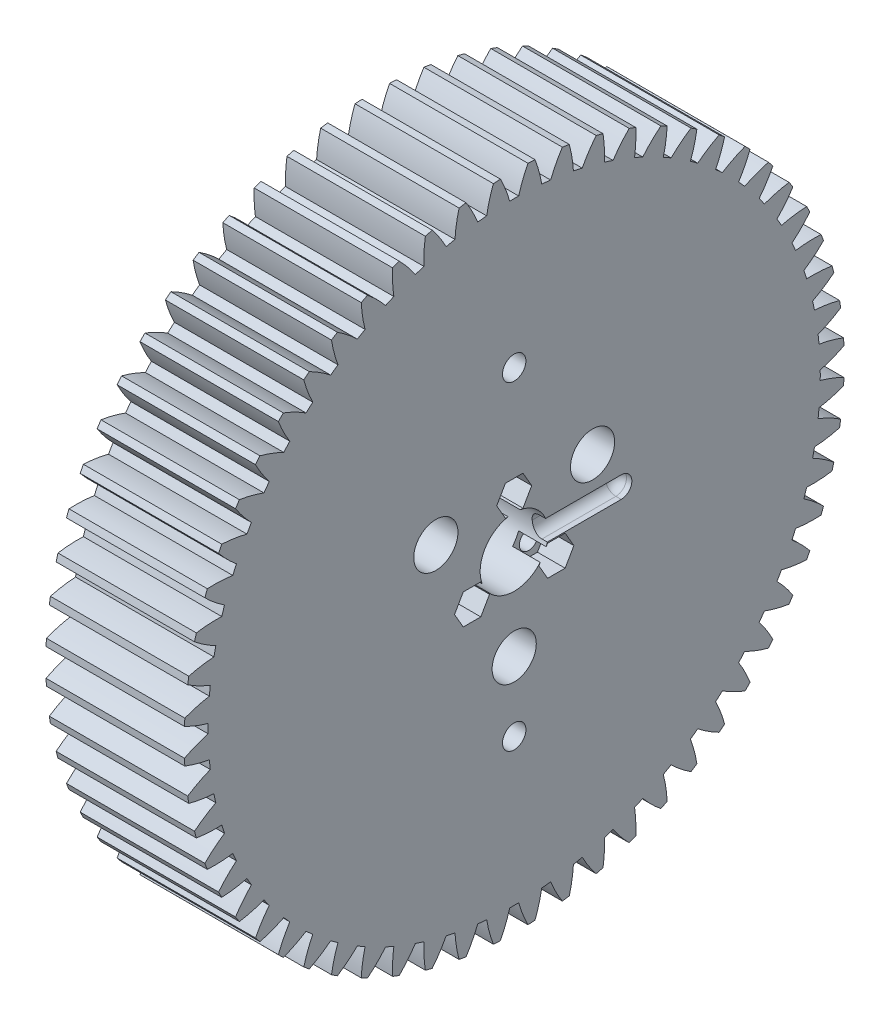
from build123d import *

# Parameters (mm, degrees)
BASPROSKE_W         = 26
BASPROSKE_H         = 62
TOOTHCUT_DEPTH      = 92.454906921
TEETHCUTS_COUNT     = 60
TEETHCUTS_ANGLE     = 354
BORSKE_R            = 12.25
BORE_DEPTH          = 50.0000508
SKETCH2_R           = 13.6
CUT_EXTRUDE1_DEPTH  = 1.5
SKETCH4_R           = 2.2
CUT_EXTRUDE2_DEPTH  = 92.381890262
SKETCH7_R           = 4.15
CUT_EXTRUDE3_DEPTH  = 17
SKETCH8_R           = 2.2
CUT_EXTRUDE4_DEPTH  = 92.381890262
CUT_EXTRUDE5_DEPTH  = 8.3
SKETCH11_R          = 12.25
SKETCH11_R_2        = 6.4
BOSS_EXTRUDE2_DEPTH = 16
SKETCH12_R          = 1.75
CUT_EXTRUDE7_DEPTH  = 16
CUT_EXTRUDE8_DEPTH  = 5.2
CUT_EXTRUDE9_DEPTH  = 3
FILLET1_R           = 2
SKETCH15_R          = 13.6
SKETCH15_R_2        = 12.25
BOSS_EXTRUDE3_DEPTH = 1.5
SKETCH16_R          = 23
SKETCH16_R_2        = 12.25
BOSS_EXTRUDE4_DEPTH = 7.5
SKETCH17_R          = 2.2
CUT_EXTRUDE10_DEPTH = 92.381890291
SKETCH18_R          = 13.6
CUT_EXTRUDE11_DEPTH = 1.5


with BuildPart() as part:
    # BasProSke → Base-Revolve (revolve)
    with BuildSketch(Plane(origin=(0, 0, 0), x_dir=(1, 0, 0), z_dir=(0, 1, 0)), mode=Mode.PRIVATE) as base_revolve_sk:
        with Locations((13, 31)):
            Rectangle(BASPROSKE_W, BASPROSKE_H)
    revolve(base_revolve_sk.sketch.rotate(Axis((-10, 0, 0), (1, 0, 0)), 180), axis=Axis((-10, 0, 0), (1, 0, 0)))

    # TooCutSke → ToothCut (cut, through all)
    with BuildSketch(Plane(origin=(0, 0, 0), x_dir=(0, 0, -1), z_dir=(1, 0, 0))):
        with BuildLine():
            ThreePointArc((0.845486153, 57.492783496), (0, 57.499), (-0.845486153, 57.492783496))
            ThreePointArc((-0.845486153, 57.492783496), (-1.608476959, 59.775867605), (-2.596335387, 61.971035877))
            ThreePointArc((-2.596335387, 61.971035877), (0, 62.0254), (2.596335387, 61.971035877))
            ThreePointArc((2.596335387, 61.971035877), (1.608476959, 59.775867605), (0.845486153, 57.492783496))
        make_face()
    toothcut = extrude(amount=TOOTHCUT_DEPTH, mode=Mode.SUBTRACT)

    # TeethCuts: ToothCut ×60 about axis
    teethcuts_axis = Axis((-10, 0, 0), (1, 0, 0))
    for i in range(1, TEETHCUTS_COUNT):
        add(toothcut.rotate(teethcuts_axis, i * TEETHCUTS_ANGLE / (TEETHCUTS_COUNT - 1)), mode=Mode.SUBTRACT)

    # BorSke → Bore (cut, symmetric)
    with BuildSketch(Plane(origin=(0, 0, 0), x_dir=(0, 0, -1), z_dir=(1, 0, 0))):
        with Locations(Location((0, 0, 0), (0, 0, 180))):
            Circle(BORSKE_R)
    extrude(amount=BORE_DEPTH, both=True, mode=Mode.SUBTRACT)

    # Sketch2 → Cut-Extrude1 (cut)
    with BuildSketch(Plane.ZY):
        Circle(SKETCH2_R)
    extrude(amount=-CUT_EXTRUDE1_DEPTH, mode=Mode.SUBTRACT)

    # Sketch4 → Cut-Extrude2 (cut, through all)
    with BuildSketch(Plane.ZY):
        with Locations((0, -17)):
            Circle(SKETCH4_R)
        with Locations((-14.722431864, 8.5)):
            Circle(SKETCH4_R)
        with Locations((14.722431864, 8.5)):
            Circle(SKETCH4_R)
    extrude(amount=-CUT_EXTRUDE2_DEPTH, mode=Mode.SUBTRACT)

    # Sketch7 → Cut-Extrude3 (cut)
    with BuildSketch(Plane(origin=(26, 0, 0), x_dir=(0, 0, -1), z_dir=(1, 0, 0))):
        with Locations((0, -17)):
            Circle(SKETCH7_R)
        with Locations((-14.722431864, 8.5)):
            Circle(SKETCH7_R)
        with Locations((14.722431864, 8.5)):
            Circle(SKETCH7_R)
    extrude(amount=-CUT_EXTRUDE3_DEPTH, mode=Mode.SUBTRACT)

    # Sketch8 → Cut-Extrude4 (cut, through all)
    with BuildSketch(Plane.ZY):
        with Locations((0, -30)):
            Circle(SKETCH8_R)
        with Locations((0, 30)):
            Circle(SKETCH8_R)
    extrude(amount=-CUT_EXTRUDE4_DEPTH, mode=Mode.SUBTRACT)

    # Sketch9 → Cut-Extrude5 (cut)
    with BuildSketch(Plane.ZY):
        Polygon((4.243524479, 30), (2.121762239, 33.675), (-2.121762239, 33.675), (-4.243524479, 30), (-2.121762239, 26.325), (2.121762239, 26.325), align=None)
        Polygon((4.243524479, -30), (2.121762239, -26.325), (-2.121762239, -26.325), (-4.243524479, -30), (-2.121762239, -33.675), (2.121762239, -33.675), align=None)
    extrude(amount=-CUT_EXTRUDE5_DEPTH, mode=Mode.SUBTRACT)

    # Sketch11 → Boss-Extrude2 (add)
    with BuildSketch(Plane(origin=(26, 0, 0), x_dir=(0, 0, -1), z_dir=(1, 0, 0))):
        with Locations(Location((0, 0, 0), (0, 0, 180))):
            Circle(SKETCH11_R)
        Circle(SKETCH11_R_2, mode=Mode.SUBTRACT)
    extrude(amount=-BOSS_EXTRUDE2_DEPTH)

    # Sketch12 → Cut-Extrude7 (cut)
    with BuildSketch(Plane.ZY.offset(-10)):
        with Locations((0, 9.148294209)):
            Circle(SKETCH12_R)
        with Locations((7.922655187, -4.574147105)):
            Circle(SKETCH12_R)
        with Locations((-7.922655187, -4.574147105)):
            Circle(SKETCH12_R)
    extrude(amount=-CUT_EXTRUDE7_DEPTH, mode=Mode.SUBTRACT)

    # Sketch13 → Cut-Extrude8 (cut)
    with BuildSketch(Plane(origin=(26, 0, 0), x_dir=(0, 0, -1), z_dir=(1, 0, 0))):
        Polygon((6.277206919, -7.424147105), (9.568103454, -7.424147105), (11.213551721, -4.574147105), (9.568103454, -1.724147105), (6.277206919, -1.724147105), (4.631758652, -4.574147105), align=None)
        Polygon((3.290896534, 9.148294209), (1.645448267, 11.998294209), (-1.645448267, 11.998294209), (-3.290896534, 9.148294209), (-1.645448267, 6.298294209), (1.645448267, 6.298294209), align=None)
        Polygon((-9.568103454, -1.724147105), (-11.213551721, -4.574147105), (-9.568103454, -7.424147105), (-6.277206919, -7.424147105), (-4.631758652, -4.574147105), (-6.277206919, -1.724147105), align=None)
    extrude(amount=-CUT_EXTRUDE8_DEPTH, mode=Mode.SUBTRACT)

    # Sketch14 → Cut-Extrude9 (cut)
    with BuildSketch(Plane(origin=(26, 0, 0), x_dir=(0, 0, -1), z_dir=(1, 0, 0))):
        with BuildLine():
            Line((0.101802401, -1.50300776), (20.101802401, -1.50300776))
            ThreePointArc((20.101802401, -1.50300776), (22.101802401, 0.49699224), (20.101802401, 2.49699224))
            Line((20.101802401, 2.49699224), (0.101802401, 2.49699224))
            Line((0.101802401, 2.49699224), (0.101802401, -1.50300776))
        make_face()
    extrude(amount=-CUT_EXTRUDE9_DEPTH, mode=Mode.SUBTRACT)

    # Fillet1
    # the kernel refuses this fillet: 2 mm, written as the material it adds along each edge
    with BuildSketch(Plane(origin=(23, -1.50300776, -1.221010181), x_dir=(1, 0, 0), z_dir=(0, 0, -1))) as fillet1_piece_1_section:
        with BuildLine():
            CenterArc((FILLET1_R, -FILLET1_R), FILLET1_R, 90, 90)
            Line((0, -FILLET1_R), (0, 0))
            Line((0, 0), (FILLET1_R, 0))
        make_face()
    fillet1_piece_1 = extrude(amount=18.88079222, mode=Mode.PRIVATE)
    fillet1_piece_1 = fillet1_piece_1 - Plane(origin=(23.453945132, 0, 0), x_dir=(0, 0, -1), z_dir=(1, 0, 0)) * Cylinder(6.4, 46, mode=Mode.PRIVATE)
    add(fillet1_piece_1)
    with BuildSketch(Plane(origin=(23, 0.49699224, -20.101802401), x_dir=(0, -1, 0), z_dir=(0, 0, 1))) as fillet1_piece_2:
        with BuildLine():
            CenterArc((2 - FILLET1_R, FILLET1_R), FILLET1_R, 270, 90)
            Line((2 - FILLET1_R, 0), (2, 0))
            Line((2, 0), (2, FILLET1_R))
        make_face()
    revolve(axis=Axis((23, 0.49699224, -20.101802401), (1, 0, 0)), revolution_arc=180)
    with BuildSketch(Plane(origin=(23, 2.49699224, -20.101802401), x_dir=(1, 0, 0), z_dir=(0, 0, 1))) as fillet1_piece_3_section:
        with BuildLine():
            CenterArc((FILLET1_R, -FILLET1_R), FILLET1_R, 90, 90)
            Line((0, -FILLET1_R), (0, 0))
            Line((0, 0), (FILLET1_R, 0))
        make_face()
    fillet1_piece_3 = extrude(amount=19.209007669, mode=Mode.PRIVATE)
    fillet1_piece_3 = fillet1_piece_3 - Plane(origin=(23.455246058, 0, 0), x_dir=(0, 0, -1), z_dir=(1, 0, 0)) * Cylinder(6.4, 47, mode=Mode.PRIVATE)
    add(fillet1_piece_3)

    # Sketch15 → Boss-Extrude3 (add)
    with BuildSketch(Plane.ZY.offset(-1.5)):
        Circle(SKETCH15_R)
        Circle(SKETCH15_R_2, mode=Mode.SUBTRACT)
    extrude(amount=BOSS_EXTRUDE3_DEPTH)

    # Sketch16 → Boss-Extrude4 (add)
    with BuildSketch(Plane.ZY):
        with Locations(Location((0, 0, 0), (0, 0, 180))):
            Circle(SKETCH16_R)
        Circle(SKETCH16_R_2, mode=Mode.SUBTRACT)
    extrude(amount=BOSS_EXTRUDE4_DEPTH)

    # Sketch17 → Cut-Extrude10 (cut, through all)
    with BuildSketch(Plane(origin=(0, 0, 0), x_dir=(0, 0, -1), z_dir=(1, 0, 0))):
        with Locations(Location((0, -17, 0), (0, 0, 180))):
            Circle(SKETCH17_R)
        with Locations(Location((14.722431864, 8.5, 0), (0, 0, 180))):
            Circle(SKETCH17_R)
        with Locations(Location((-14.722431864, 8.5, 0), (0, 0, 180))):
            Circle(SKETCH17_R)
    extrude(amount=-CUT_EXTRUDE10_DEPTH, mode=Mode.SUBTRACT)

    # Sketch18 → Cut-Extrude11 (cut)
    with BuildSketch(Plane.ZY.offset(7.5)):
        Circle(SKETCH18_R)
    extrude(amount=-CUT_EXTRUDE11_DEPTH, mode=Mode.SUBTRACT)


solid = part.part
